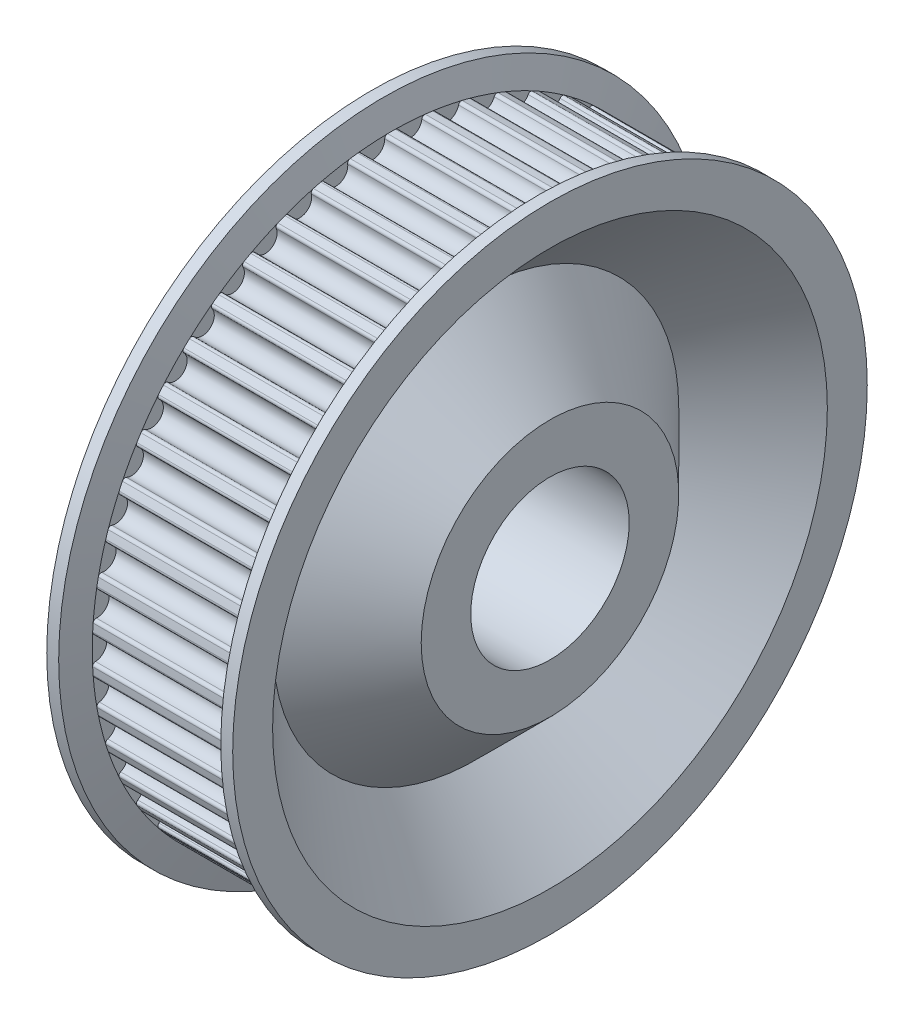
from build123d import *

# Parameters (mm, degrees)
SKETCH_2_R      = 4
BORE_DEPTH      = 25.87752792
F_20TOOTH_START = -1
SKETCH_3_R      = 0.6
F_20TOOTH_DEPTH = 7
FILLET_1_R      = 0.15


with BuildPart() as part:
    # Эскиз1 → Body (revolve)
    with BuildSketch(Plane.XY):
        Polygon((0, 7.5), (0, 0), (9, 0), (9, 12.478956575), (8.958790953, 12.520165623), (9, 12.56137467), (9, 16.014212221), (8.398179889, 16.014212221), (8, 15.1), (1, 15.1), (0.601820111, 16.399563948), (0, 16.399563948), align=None)
    revolve(axis=Axis((0, 0, 0), (1, 0, 0)))

    # Эскиз2 → Bore (cut, through all)
    with BuildSketch(Plane(origin=(9, 0, 0), x_dir=(0, 0, -1), z_dir=(1, 0, 0))):
        Circle(SKETCH_2_R)
    extrude(amount=-BORE_DEPTH, mode=Mode.SUBTRACT)

    # Эскиз3 → 20tooth (cut)
    with BuildSketch(Plane.ZY.offset(F_20TOOTH_START)):
        with Locations((14.852366667, -1.876290249)):
            Circle(SKETCH_3_R)
        with Locations((-12.111318403, -8.79938789)):
            Circle(SKETCH_3_R)
        with Locations((14.500089795, -3.722990281)):
            Circle(SKETCH_3_R)
        with Locations((13.919137846, -5.510976531)):
            Circle(SKETCH_3_R)
        with Locations((13.118672778, -7.21205139)):
            Circle(SKETCH_3_R)
        with Locations((12.111318403, -8.79938789)):
            Circle(SKETCH_3_R)
        with Locations((14.970412843, 0)):
            Circle(SKETCH_3_R)
        with Locations((10.912961302, -10.247952786)):
            Circle(SKETCH_3_R)
        with Locations((9.542500283, -11.534901346)):
            Circle(SKETCH_3_R)
        with Locations((8.021548333, -12.63993762)):
            Circle(SKETCH_3_R)
        with Locations((6.374091775, -13.545634527)):
            Circle(SKETCH_3_R)
        with Locations((4.626111981, -14.237708686)):
            Circle(SKETCH_3_R)
        with Locations((2.805175638, -14.705245674)):
            Circle(SKETCH_3_R)
        with Locations((0.94, -14.940872153)):
            Circle(SKETCH_3_R)
        with Locations((-0.94, -14.940872153)):
            Circle(SKETCH_3_R)
        with Locations((-13.118672778, -7.21205139)):
            Circle(SKETCH_3_R)
        with Locations((-13.919137846, -5.510976531)):
            Circle(SKETCH_3_R)
        with Locations((-2.805175638, -14.705245674)):
            Circle(SKETCH_3_R)
        with Locations((-4.626111981, -14.237708686)):
            Circle(SKETCH_3_R)
        with Locations((-6.374091775, -13.545634527)):
            Circle(SKETCH_3_R)
        with Locations((-8.021548333, -12.63993762)):
            Circle(SKETCH_3_R)
        with Locations((-9.542500283, -11.534901346)):
            Circle(SKETCH_3_R)
        with Locations((-10.912961302, -10.247952786)):
            Circle(SKETCH_3_R)
        with Locations((-14.500089795, -3.722990281)):
            Circle(SKETCH_3_R)
        with Locations((-14.852366667, -1.876290249)):
            Circle(SKETCH_3_R)
        with Locations((-14.970412843, 0)):
            Circle(SKETCH_3_R)
        with Locations((-14.852366667, 1.876290249)):
            Circle(SKETCH_3_R)
        with Locations((-14.500089795, 3.722990281)):
            Circle(SKETCH_3_R)
        with Locations((-13.919137846, 5.510976531)):
            Circle(SKETCH_3_R)
        with Locations((-13.118672778, 7.21205139)):
            Circle(SKETCH_3_R)
        with Locations((-12.111318403, 8.79938789)):
            Circle(SKETCH_3_R)
        with Locations((-10.912961302, 10.247952786)):
            Circle(SKETCH_3_R)
        with Locations((-9.542500283, 11.534901346)):
            Circle(SKETCH_3_R)
        with Locations((-8.021548333, 12.63993762)):
            Circle(SKETCH_3_R)
        with Locations((-6.374091775, 13.545634527)):
            Circle(SKETCH_3_R)
        with Locations((-4.626111981, 14.237708686)):
            Circle(SKETCH_3_R)
        with Locations((-2.805175638, 14.705245674)):
            Circle(SKETCH_3_R)
        with Locations((-0.94, 14.940872153)):
            Circle(SKETCH_3_R)
        with Locations((0.94, 14.940872153)):
            Circle(SKETCH_3_R)
        with Locations((2.805175638, 14.705245674)):
            Circle(SKETCH_3_R)
        with Locations((4.626111981, 14.237708686)):
            Circle(SKETCH_3_R)
        with Locations((6.374091775, 13.545634527)):
            Circle(SKETCH_3_R)
        with Locations((8.021548333, 12.63993762)):
            Circle(SKETCH_3_R)
        with Locations((9.542500283, 11.534901346)):
            Circle(SKETCH_3_R)
        with Locations((10.912961302, 10.247952786)):
            Circle(SKETCH_3_R)
        with Locations((12.111318403, 8.79938789)):
            Circle(SKETCH_3_R)
        with Locations((13.118672778, 7.21205139)):
            Circle(SKETCH_3_R)
        with Locations((13.919137846, 5.510976531)):
            Circle(SKETCH_3_R)
        with Locations((14.500089795, 3.722990281)):
            Circle(SKETCH_3_R)
        with Locations((14.852366667, 1.876290249)):
            Circle(SKETCH_3_R)
    extrude(amount=-F_20TOOTH_DEPTH, mode=Mode.SUBTRACT)

    # Скругление1
    fillet_1_edges = [part.edges().sort_by_distance(p)[0] for p in [
        (4.5, 0.588257297, 15.088537151),
        (4.5, -0.588257297, 15.088537151),
        (4.5, -2.474713864, 14.895831339),
        (4.5, -1.307476438, 15.043287718),
        (4.5, -4.322142714, 14.468209369),
        (4.5, -3.182590489, 14.760796651),
        (4.5, -6.101408792, 13.812415095),
        (4.5, -5.007513187, 14.245519004),
        (4.5, -7.784452009, 12.938790783),
        (4.5, -6.75346441, 13.505581012),
        (4.5, -9.344729767, 11.861114011),
        (4.5, -8.392909465, 12.552651939),
        (4.5, -10.757635554, 10.596380386),
        (4.5, -9.899993325, 11.401760047),
        (4.5, -12.000887002, 9.164535512),
        (4.5, -11.250948375, 10.071055588),
        (4.5, -13.054877294, 7.588160439),
        (4.5, -12.424469249, 8.581524566),
        (4.5, -13.902984372, 5.892115542),
        (4.5, -13.402048821, 6.956657775),
        (4.5, -14.531833081, 4.103148464),
        (4.5, -14.168270077, 5.222080336),
        (4.5, -14.931506101, 2.249472283),
        (4.5, -14.71104925, 3.40514757),
        (4.5, -15.095700351, 0.360320581),
        (4.5, -15.021826388, 1.534513593),
        (4.5, -15.021826388, -1.534513593),
        (4.5, -15.095700351, -0.360320581),
        (4.5, -14.71104925, -3.40514757),
        (4.5, -14.931506101, -2.249472283),
        (4.5, -14.531833081, -4.103148464),
        (4.5, -13.902984372, -5.892115542),
        (4.5, -13.054877294, -7.588160439),
        (4.5, -12.000887002, -9.164535512),
        (4.5, -10.757635554, -10.596380386),
        (4.5, -9.899993325, -11.401760047),
        (4.5, -11.250948375, -10.071055588),
        (4.5, -14.168270077, -5.222080336),
        (4.5, -13.402048821, -6.956657775),
        (4.5, -12.424469249, -8.581524566),
        (4.5, -4.322142714, -14.468209369),
        (4.5, -5.007513187, -14.245519004),
        (4.5, -6.101408792, -13.812415095),
        (4.5, -6.75346441, -13.505581012),
        (4.5, -7.784452009, -12.938790783),
        (4.5, -8.392909465, -12.552651939),
        (4.5, -9.344729767, -11.861114011),
        (4.5, -3.182590489, -14.760796651),
        (4.5, -2.474713864, -14.895831339),
        (4.5, -1.307476438, -15.043287718),
        (4.5, -0.588257297, -15.088537151),
        (4.5, 0.588257297, -15.088537151),
        (4.5, 1.307476438, -15.043287718),
        (4.5, 2.474713864, -14.895831339),
        (4.5, 3.182590489, -14.760796651),
        (4.5, 4.322142714, -14.468209369),
        (4.5, 5.007513187, -14.245519004),
        (4.5, 6.101408792, -13.812415095),
        (4.5, 6.75346441, -13.505581012),
        (4.5, 7.784452009, -12.938790783),
        (4.5, 8.392909465, -12.552651939),
        (4.5, 9.344729767, -11.861114011),
        (4.5, 9.899993325, -11.401760047),
        (4.5, 10.757635554, -10.596380386),
        (4.5, 11.250948375, -10.071055588),
        (4.5, 12.000887002, -9.164535512),
        (4.5, 12.424469249, -8.581524566),
        (4.5, 13.054877294, -7.588160439),
        (4.5, 13.402048821, -6.956657775),
        (4.5, 13.902984372, -5.892115542),
        (4.5, 14.168270077, -5.222080336),
        (4.5, 14.531833081, -4.103148464),
        (4.5, 14.71104925, -3.40514757),
        (4.5, 14.931506101, -2.249472283),
        (4.5, 15.021826388, -1.534513593),
        (4.5, 15.095700351, -0.360320581),
        (4.5, 15.095700351, 0.360320581),
        (4.5, 15.021826388, 1.534513593),
        (4.5, 14.931506101, 2.249472283),
        (4.5, 14.71104925, 3.40514757),
        (4.5, 14.531833081, 4.103148464),
        (4.5, 14.168270077, 5.222080336),
        (4.5, 13.902984372, 5.892115542),
        (4.5, 13.402048821, 6.956657775),
        (4.5, 13.054877294, 7.588160439),
        (4.5, 12.424469249, 8.581524566),
        (4.5, 12.000887002, 9.164535512),
        (4.5, 11.250948375, 10.071055588),
        (4.5, 10.757635554, 10.596380386),
        (4.5, 9.899993325, 11.401760047),
        (4.5, 9.344729767, 11.861114011),
        (4.5, 8.392909465, 12.552651939),
        (4.5, 7.784452009, 12.938790783),
        (4.5, 6.75346441, 13.505581012),
        (4.5, 6.101408792, 13.812415095),
        (4.5, 5.007513187, 14.245519004),
        (4.5, 4.322142714, 14.468209369),
        (4.5, 3.182590489, 14.760796651),
        (4.5, 2.474713864, 14.895831339),
        (4.5, 1.307476438, 15.043287718),
    ]]
    fillet(fillet_1_edges, radius=FILLET_1_R)

    # Esquisse1 → Enlèvement de matière-Révolution1 (revolve, cut)
    with BuildSketch(Plane(origin=(0, 0, 0), x_dir=(1, 0, 0), z_dir=(0, 1, 0))):
        Polygon((9, -6.499644451), (5.25, -10.249644451), (9, -13.999644451), align=None)
    revolve(axis=Axis((0, 0, 0), (1, 0, 0)), mode=Mode.SUBTRACT)


solid = part.part
